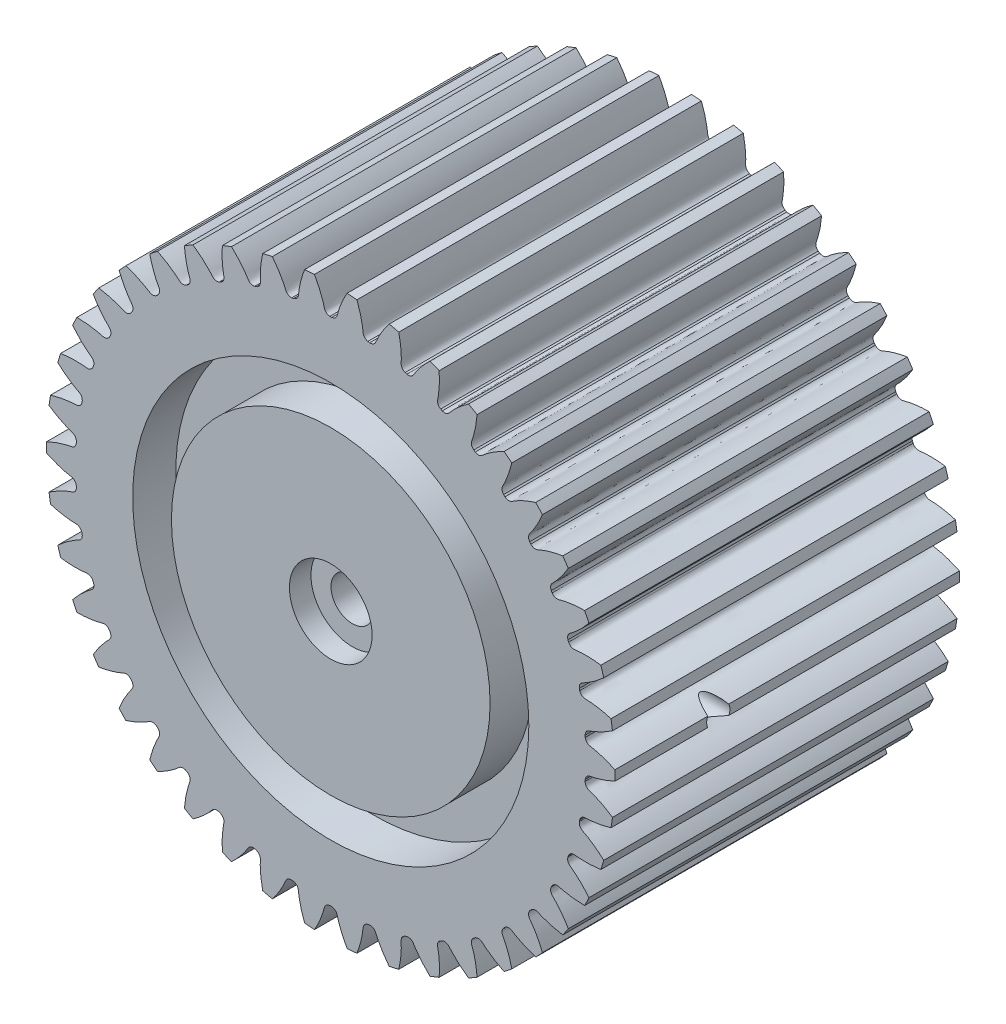
from build123d import *

# Parameters (mm, degrees)
SKETCH_1_R               = 33
EXTRUDE_1_DEPTH          = 40
CUT_EXTRUDE_1_DEPTH      = 62.465437443
PATTERN_CIRCULAR_1_COUNT = 42
SKETCH_5_R               = 4.8
CUT_EXTRUDE_2_DEPTH      = 2.5
SKETCH_6_R               = 2.475
CUT_EXTRUDE_3_DEPTH      = 4.6
CUT_EXTRUDE_4_DEPTH      = 11
CUT_EXTRUDE_6_DEPTH      = 62.436235961
CUT_EXTRUDE_6_DEPTH_BACK = 62.436235961
SKETCH_8_R               = 1.35
SKETCH_9_R               = 23
SKETCH_9_R_2             = 18.5
CUT_EXTRUDE_7_DEPTH      = 5


with BuildPart() as part:
    # 草图1 → 凸台-拉伸1 (new body)
    with BuildSketch(Plane.XY):
        Circle(SKETCH_1_R)
    extrude(amount=EXTRUDE_1_DEPTH)

    # 草图2 → 切除-拉伸1 (cut, through all)
    with BuildSketch(Plane.XY):
        with BuildLine():
            ThreePointArc((0.10744814, 29.624805145), (0, 29.625), (-0.10744814, 29.624805145))
            add(Edge.make_bspline(
                [(-0.10744814, 29.624805145), (-0.675368307, 29.706821555), (-0.732973314, 30.121094015), (-0.85852823, 30.567348275), (-0.904185225, 30.71981641), (-0.956641755, 30.882541704), (-1.016154007, 31.055403334), (-1.08319767, 31.238151542), (-1.15817534, 31.430558107), (-1.241502832, 31.63237193), (-1.333583304, 31.843332337), (-1.434814407, 32.063165406), (-1.545585765, 32.291585275), (-1.666279283, 32.528294011), (-1.797268642, 32.772981905), (-1.938919029, 33.025327653), (-2.091586815, 33.284998584), (-2.255619245, 33.551650884), (-2.43135414, 33.824929828), (-2.619119597, 34.104470021), (-2.819233701, 34.38989565), (-3.03200424, 34.680820735), (-3.257728424, 34.976849396), (-3.496692616, 35.277576122), (-3.749172069, 35.582586046), (-4.015430657, 35.891455231), (-4.295720656, 36.203750962), (-4.590282382, 36.51903204), (-5.007868361, 36.948447262), (-5.335003327, 37.265011311), (-5.560003737, 37.474412001)],
                knots=[0, 0, 0, 0, 0.112031818, 0.127240278, 0.143671307, 0.161324905, 0.180201073, 0.200299811, 0.221621119, 0.244164996, 0.267931442, 0.292920459, 0.319132045, 0.3465662, 0.375222926, 0.40510222, 0.436204085, 0.468528519, 0.502075523, 0.536845096, 0.572837239, 0.610051952, 0.648489234, 0.688149086, 0.729031508, 0.771136499, 0.81446406, 0.859014191, 0.904786891, 1, 1, 1, 1], degree=3))
            ThreePointArc((-5.560003737, 37.474412001), (0, 37.884630081), (5.560003737, 37.474412001))
            add(Edge.make_bspline(
                [(0.10744814, 29.624805145), (0.675368307, 29.706821555), (0.732973314, 30.121094015), (0.85852823, 30.567348275), (0.904185225, 30.71981641), (0.956641755, 30.882541704), (1.016154007, 31.055403334), (1.08319767, 31.238151542), (1.15817534, 31.430558107), (1.241502832, 31.63237193), (1.333583304, 31.843332337), (1.434814407, 32.063165406), (1.545585765, 32.291585275), (1.666279283, 32.528294011), (1.797268642, 32.772981905), (1.938919029, 33.025327653), (2.091586815, 33.284998584), (2.255619245, 33.551650884), (2.43135414, 33.824929828), (2.619119597, 34.104470021), (2.819233701, 34.38989565), (3.03200424, 34.680820735), (3.257728424, 34.976849396), (3.496692616, 35.277576122), (3.749172069, 35.582586046), (4.015430657, 35.891455231), (4.295720656, 36.203750962), (4.590282382, 36.51903204), (5.007868361, 36.948447262), (5.335003327, 37.265011311), (5.560003737, 37.474412001)],
                knots=[0, 0, 0, 0, 0.112031818, 0.127240278, 0.143671307, 0.161324905, 0.180201073, 0.200299811, 0.221621119, 0.244164996, 0.267931442, 0.292920459, 0.319132045, 0.3465662, 0.375222926, 0.40510222, 0.436204085, 0.468528519, 0.502075523, 0.536845096, 0.572837239, 0.610051952, 0.648489234, 0.688149086, 0.729031508, 0.771136499, 0.81446406, 0.859014191, 0.904786891, 1, 1, 1, 1], degree=3))
        make_face()
    cut_extrude_1 = extrude(amount=CUT_EXTRUDE_1_DEPTH, mode=Mode.SUBTRACT)

    # 阵列(圆周)1: 切除-拉伸1 ×42 about axis
    pattern_circular_1_axis = Axis((0, 0, -1.5), (0, 0, 1))
    for i in range(1, PATTERN_CIRCULAR_1_COUNT):
        add(cut_extrude_1.rotate(pattern_circular_1_axis, i * 360 / PATTERN_CIRCULAR_1_COUNT), mode=Mode.SUBTRACT)

    # 草图5 → 切除-拉伸2 (cut)
    with BuildSketch(Plane.XY.offset(40)):
        Circle(SKETCH_5_R)
    extrude(amount=-CUT_EXTRUDE_2_DEPTH, mode=Mode.SUBTRACT)

    # 草图6 → 切除-拉伸3 (cut)
    with BuildSketch(Plane.XY.offset(37.5)):
        Circle(SKETCH_6_R)
    extrude(amount=-CUT_EXTRUDE_3_DEPTH, mode=Mode.SUBTRACT)

    # 草图7 → 切除-拉伸4 (cut)
    with BuildSketch(Plane.XY.offset(32.9)):
        with BuildLine():
            Line((-1.475, 1.987460691), (-1.475, -1.987460691))
            ThreePointArc((-1.475, -1.987460691), (0, -2.475), (1.475, -1.987460691))
            Line((1.475, -1.987460691), (1.475, 1.987460691))
            ThreePointArc((1.475, 1.987460691), (0, 2.475), (-1.475, 1.987460691))
        make_face()
    extrude(amount=-CUT_EXTRUDE_4_DEPTH, mode=Mode.SUBTRACT)

    # 草图8 → 切除-拉伸6 (cut, two sides: drawn at the far end of the back side and taken through both)
    with BuildSketch(Plane(origin=(0, 0, 0), x_dir=(0, -1, 0), z_dir=(1, 0, 0)).offset(-CUT_EXTRUDE_6_DEPTH_BACK)):
        with Locations((0, -28)):
            Circle(SKETCH_8_R)
    extrude(amount=CUT_EXTRUDE_6_DEPTH + CUT_EXTRUDE_6_DEPTH_BACK, mode=Mode.SUBTRACT)

    # 草图9 → 切除-拉伸7 (cut)
    with BuildSketch(Plane.XY.offset(40)):
        Circle(SKETCH_9_R)
        Circle(SKETCH_9_R_2, mode=Mode.SUBTRACT)
    extrude(amount=-CUT_EXTRUDE_7_DEPTH, mode=Mode.SUBTRACT)


solid = part.part
